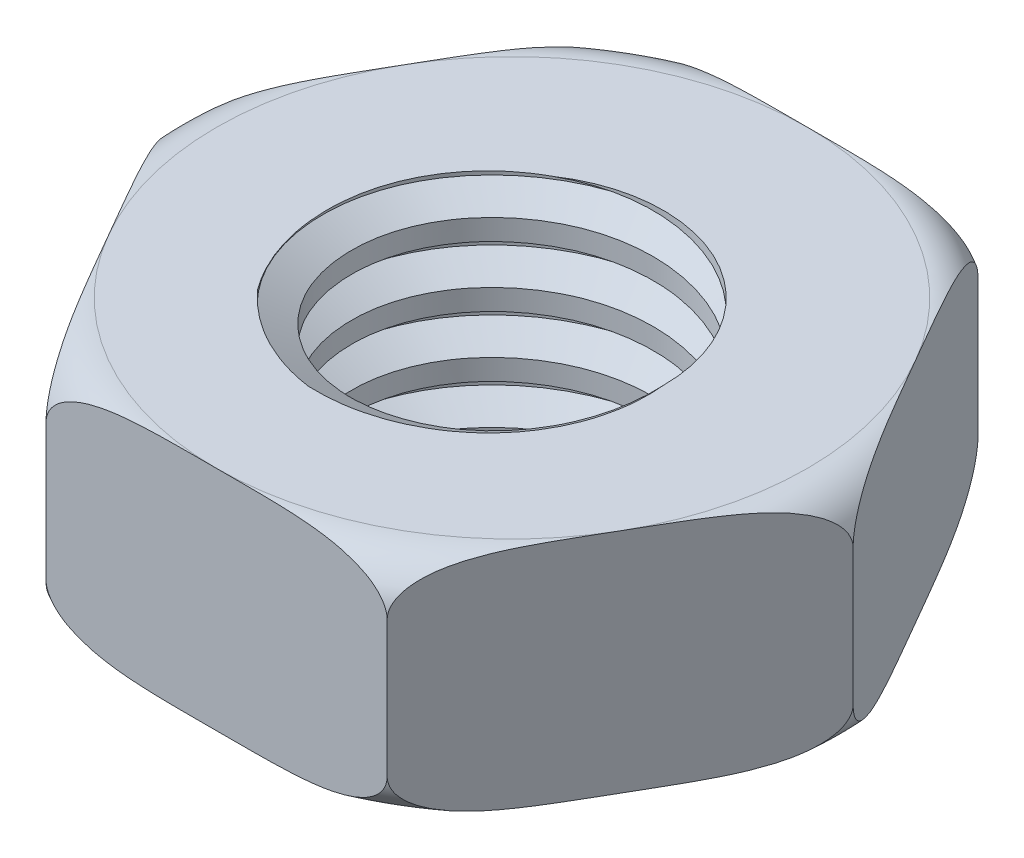
from build123d import *

# Parameters (mm, degrees)
SKETCH1_R           = 1
BOSS_EXTRUDE1_DEPTH = 0.75
THREAD1_PITCH       = 0.4


with BuildPart() as part:
    # Sketch1 → Boss-Extrude1 (new, symmetric)
    with BuildSketch(Plane(origin=(0, 0, 0), x_dir=(1, 0, 0), z_dir=(0, 1, 0))):
        Polygon((2.25166605, 0), (1.125833025, 1.95), (-1.125833025, 1.95), (-2.25166605, 0), (-1.125833025, -1.95), (1.125833025, -1.95), align=None)
        with Locations(Location((0, 0, 0), (0, 0, 270))):
            Circle(SKETCH1_R, mode=Mode.SUBTRACT)
    extrude(amount=BOSS_EXTRUDE1_DEPTH, both=True)

    # Sketch2 → Cut-Revolve1 (revolve, cut)
    with BuildSketch(Plane.XY):
        with BuildLine():
            Line((2.25166605, 0.75), (2.25166605, 0.44833395))
            ThreePointArc((2.25166605, 0.44833395), (2.163310109, 0.66164406), (1.95, 0.75))
            Line((1.95, 0.75), (2.25166605, 0.75))
        make_face()
        with BuildLine():
            Line((1.95, -0.75), (2.25166605, -0.75))
            Line((2.25166605, -0.75), (2.25166605, -0.44833395))
            ThreePointArc((2.25166605, -0.44833395), (2.163310109, -0.66164406), (1.95, -0.75))
        make_face()
    revolve(axis=Axis((0, 0.75, 0), (0, -1, 0)), mode=Mode.SUBTRACT)

    # Thread1: arcs per turn and ends read off the stored shape
    # Thread1: the profile of Thread Profile1 profile screwed along a right-hand helix through 12.5 turns, 6 arcs to a turn; built about Z, then put on its axis
    thread1_z = Axis((0, 0, 0), (0, 0, 1))
    thread1_corners = [(-0.9997, 0, -5.000173205), (-1.189443056, 0, -4.890625), (-1.189443056, 0, -4.846875), (-0.9997, 0, -4.737326796)]
    with BuildLine(mode=Mode.PRIVATE) as thread1_profile:
        Line(thread1_corners[0], thread1_corners[1])
        Line(thread1_corners[1], thread1_corners[2])
        Line(thread1_corners[2], thread1_corners[3])
        Line(thread1_corners[3], thread1_corners[0])
    thread1_cap = Face(thread1_profile.wire())
    thread1_turn_angles = [0, 30, 60, 90, 120, 150, 180, 210, 240, 270, 300, 330, 360]
    thread1_turn_weights = [1, 0.8660254037844387, 1, 0.8660254037844387, 1, 0.8660254037844387, 1, 0.8660254037844387, 1, 0.8660254037844387, 1, 0.8660254037844387, 1]
    thread1_turn_rails = [Edge.make_bspline([Vector(p[0], p[1], 0).rotate(thread1_z, thread1_turn_angles[k]) / thread1_turn_weights[k] + Vector(0, 0, p[2] + THREAD1_PITCH * thread1_turn_angles[k] / 360) for k in range(13)], [0, 0, 0, 1, 1, 2, 2, 3, 3, 4, 4, 5, 5, 6, 6, 6], 2, thread1_turn_weights) for p in thread1_corners]
    thread1_turn_sides = [Face.make_surface_from_curves(thread1_turn_rails[p[0]], thread1_turn_rails[p[1]]) for p in [(0, 1), (1, 2), (2, 3), (3, 0)]]
    thread1_last_angles = [4320, 4350, 4380, 4410, 4440, 4470, 4500]
    thread1_last_weights = [1, 0.8660254037844387, 1, 0.8660254037844387, 1, 0.8660254037844387, 1]
    thread1_last_rails = [Edge.make_bspline([Vector(p[0], p[1], 0).rotate(thread1_z, thread1_last_angles[k]) / thread1_last_weights[k] + Vector(0, 0, p[2] + THREAD1_PITCH * thread1_last_angles[k] / 360) for k in range(7)], [0, 0, 0, 1, 1, 2, 2, 3, 3, 3], 2, thread1_last_weights) for p in thread1_corners]
    thread1_last_sides = [Face.make_surface_from_curves(thread1_last_rails[p[0]], thread1_last_rails[p[1]]) for p in [(0, 1), (1, 2), (2, 3), (3, 0)]]
    thread1 = Plane(origin=(0, 0.75, 0), x_dir=(1, 0, 0), z_dir=(0, 1, 0)) * Solid(Shell([*[p.moved(Location((0, 0, THREAD1_PITCH * i))) for i in range(12) for p in thread1_turn_sides], *thread1_last_sides, thread1_cap, thread1_cap.rotate(thread1_z, 4500).moved(Location((0, 0, THREAD1_PITCH * 4500 / 360)))]))
    add(thread1, mode=Mode.SUBTRACT)


solid = part.part
